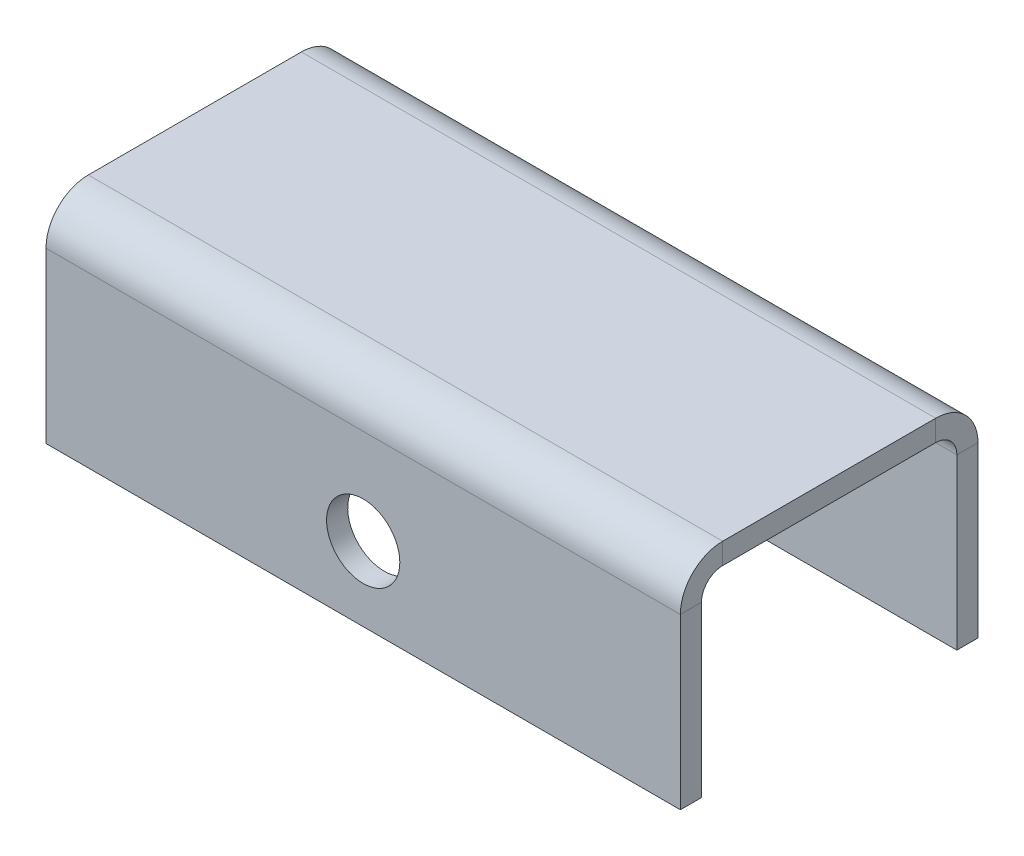
from build123d import *

# Parameters (mm, degrees)
SKETCH1_W                         = 76.2
SKETCH1_H                         = 35.75
BASE_FLANGE1_DEPTH                = 2.54
EDGE_FLANGE1_STRIP_W              = 15.24
EDGE_FLANGE1_STRIP_H              = 2.54
EDGE_FLANGE1_STRIP_CUT_DEPTH      = 76.2
EDGE_FLANGE1_STRIP_2_W            = 15.24
EDGE_FLANGE1_STRIP_2_H            = 2.54
EDGE_FLANGE1_STRIP_CUT_2_DEPTH    = 76.2
EDGE_FLANGE1_DEPTH                = 76.2
EDGE_FLANGE1_BEND_DEPTH           = 76.2
TAP_DRILL_FOR_M10X1_25_TAP1_D     = 8.8
TAP_DRILL_FOR_M10X1_25_TAP1_DEPTH = 35.75
TAP_DRILL_FOR_M10X1_25_TAP1_TIP   = 2.643786724


# Sheet-metal steps are written as plain solids
with BuildPart() as part:
    # Sketch1 → Base-Flange1 (new body)
    with BuildSketch(Plane(origin=(0, 0, 0), x_dir=(1, 0, 0), z_dir=(0, 1, 0))):
        with Locations((37.147058824, -17.382352941)):
            Rectangle(SKETCH1_W, SKETCH1_H)
    extrude(amount=-BASE_FLANGE1_DEPTH)

    # Edge-Flange1 strip (across the edge) → Edge-Flange1 strip cut (cut)
    with BuildSketch(Plane(origin=(75.247058824, -2.54, 35.257352941), x_dir=(0, 0, -1), z_dir=(-1, 0, 0))):
        with Locations((-2.54, -1.27)):
            Rectangle(EDGE_FLANGE1_STRIP_W, EDGE_FLANGE1_STRIP_H)
    extrude(amount=EDGE_FLANGE1_STRIP_CUT_DEPTH, mode=Mode.SUBTRACT)

    # Edge-Flange1 strip 2 (across the edge) → Edge-Flange1 strip cut 2 (cut)
    with BuildSketch(Plane(origin=(-0.952941176, -2.54, -0.492647059), x_dir=(0, 0, 1), z_dir=(1, 0, 0))):
        with Locations((-2.54, -1.27)):
            Rectangle(EDGE_FLANGE1_STRIP_2_W, EDGE_FLANGE1_STRIP_2_H)
    extrude(amount=EDGE_FLANGE1_STRIP_CUT_2_DEPTH, mode=Mode.SUBTRACT)

    # Edge-Flange1 section (across the edge) → Edge-Flange1 (add)
    with BuildSketch(Plane(origin=(75.247058824, -2.54, 35.257352941), x_dir=(0, 0, -1), z_dir=(-1, 0, 0))):
        with BuildLine():
            Line((0, 2.54), (0, 22.86))
            Line((0, 22.86), (2.54, 22.86))
            Line((2.54, 22.86), (2.54, 2.54))
            ThreePointArc((2.54, 2.54), (3.283948776, 0.743948776), (5.08, 0))
            Line((5.08, 0), (5.08, -2.54))
            ThreePointArc((5.08, -2.54), (1.487897552, -1.052102448), (0, 2.54))
        make_face()
    extrude(amount=EDGE_FLANGE1_DEPTH)

    # Edge-Flange1 section 2 (across the edge) → Edge-Flange1 bend (add)
    with BuildSketch(Plane(origin=(-0.952941176, -2.54, -0.492647059), x_dir=(0, 0, 1), z_dir=(1, 0, 0))):
        with BuildLine():
            Line((0, 2.54), (0, 22.86))
            Line((0, 22.86), (2.54, 22.86))
            Line((2.54, 22.86), (2.54, 2.54))
            ThreePointArc((2.54, 2.54), (3.283948776, 0.743948776), (5.08, 0))
            Line((5.08, 0), (5.08, -2.54))
            ThreePointArc((5.08, -2.54), (1.487897552, -1.052102448), (0, 2.54))
        make_face()
    extrude(amount=EDGE_FLANGE1_BEND_DEPTH)

    # Tap Drill for M10x1.25 Tap1
    with Locations(Plane.XY.offset(35.257352941)):
        with Locations((37.147058824, -16.51)):
            Hole(TAP_DRILL_FOR_M10X1_25_TAP1_D / 2, depth=TAP_DRILL_FOR_M10X1_25_TAP1_DEPTH)
            with Locations((0, 0, -(TAP_DRILL_FOR_M10X1_25_TAP1_DEPTH + TAP_DRILL_FOR_M10X1_25_TAP1_TIP / 2))):  # 118° drill point
                Cone(0, TAP_DRILL_FOR_M10X1_25_TAP1_D / 2, TAP_DRILL_FOR_M10X1_25_TAP1_TIP, mode=Mode.SUBTRACT)


solid = part.part
